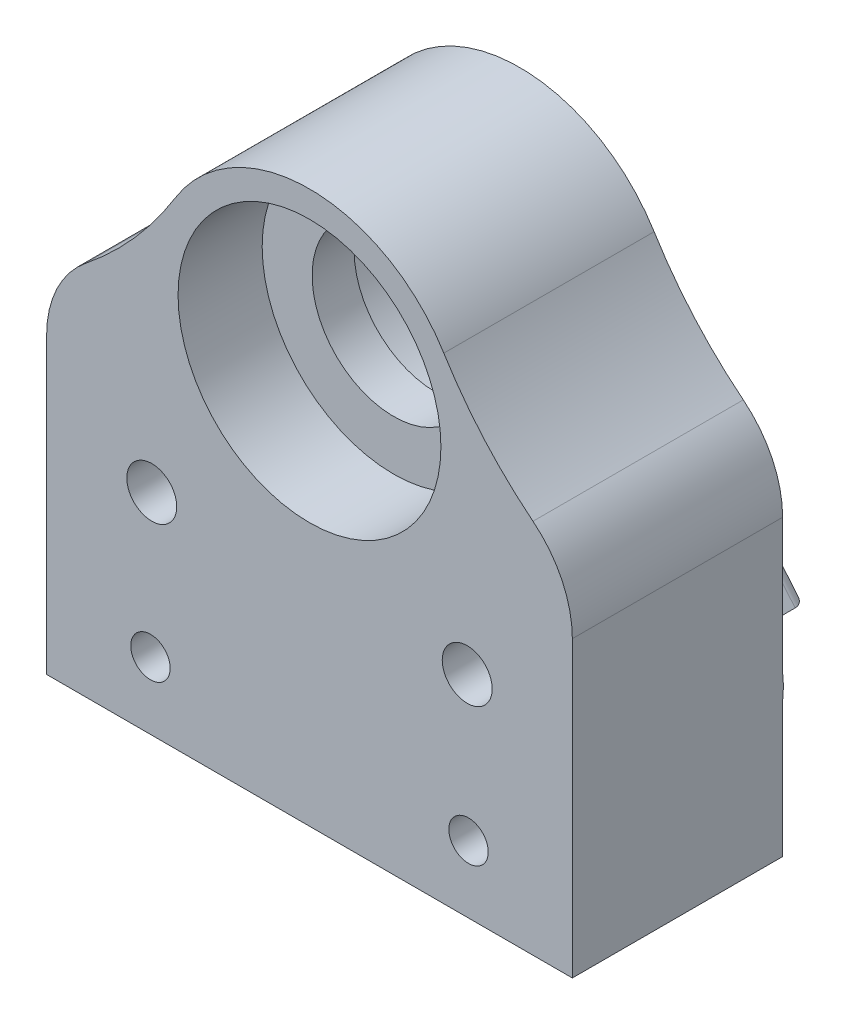
from build123d import *

# Parameters (mm, degrees)
EXTRUDE_1_DEPTH          = 4
EXTRUDE_1_DEPTH_BACK     = 4
SKETCH_2_R               = 0.95
SKETCH_2_R_2             = 0.75
SKETCH_3_R               = 5
CUT_EXTRUDE_1_DEPTH      = 3.2
SKETCH_6_R               = 3.1
CUT_EXTRUDE_2_DEPTH      = 24.749526311
EXTRUDE_3_DEPTH          = 3.2
CUT_EXTRUDE_3_DEPTH      = 1.2
CUT_EXTRUDE_3_DEPTH_BACK = 0.8
SKETCH_10_R              = 0.95
EXTRUDE_4_DEPTH          = 2
FILLET_4_R               = 2
FILLET_START             = -7
FILLET_5_2_DEPTH         = 9
FILLET_START_2           = -2
FILLET_5_3_DEPTH         = 9
SKETCH_11_R              = 1.1
CUT_EXTRUDE_4_DEPTH      = 5


with BuildPart() as part:
    # 草图2 → 凸台-拉伸1 (new, two sides: drawn at the far end of the back side and taken through both)
    with BuildSketch(Plane.XY.offset(-EXTRUDE_1_DEPTH_BACK)):
        with BuildLine():
            Line((-10, 11.178983643), (-10, 0))
            Line((-10, 0), (10, 0))
            Line((10, 0), (10, 11.178983643))
            ThreePointArc((10, 11.178983643), (9.606342006, 12.909387452), (8.502851331, 14.299197613))
            ThreePointArc((8.502851331, 14.299197613), (6.641519688, 16.075059286), (5.11101252, 18.142857143))
            ThreePointArc((5.11101252, 18.142857143), (0, 21), (-5.11101252, 18.142857143))
            ThreePointArc((-5.11101252, 18.142857143), (-6.641519688, 16.075059286), (-8.502851331, 14.299197613))
            ThreePointArc((-8.502851331, 14.299197613), (-9.606342006, 12.909387452), (-10, 11.178983643))
        make_face()
        with Locations((-6, 8)):
            Circle(SKETCH_2_R, mode=Mode.SUBTRACT)
        with Locations((-6.05, 2.55)):
            Circle(SKETCH_2_R_2, mode=Mode.SUBTRACT)
        with Locations(Location((6.05, 2.55, 0), (0, 0, 180))):
            Circle(SKETCH_2_R_2, mode=Mode.SUBTRACT)
        with Locations(Location((6, 8, 0), (0, 0, 180))):
            Circle(SKETCH_2_R, mode=Mode.SUBTRACT)
    extrude(amount=EXTRUDE_1_DEPTH + EXTRUDE_1_DEPTH_BACK)

    # 草图3 → 切除-拉伸1 (cut)
    with BuildSketch(Plane.XY.offset(4)):
        with Locations((0, 15)):
            Circle(SKETCH_3_R)
    cut_extrude_1 = extrude(amount=-CUT_EXTRUDE_1_DEPTH, mode=Mode.SUBTRACT)

    # 镜向1: 切除-拉伸1 across plane
    add(cut_extrude_1.mirror(Plane.XY), mode=Mode.SUBTRACT)

    # 草图6 → 切除-拉伸2 (cut, through all)
    with BuildSketch(Plane.XY.offset(0.8)):
        with Locations((0, 15)):
            Circle(SKETCH_6_R)
    extrude(amount=-CUT_EXTRUDE_2_DEPTH, mode=Mode.SUBTRACT)

    # 草图8 → 凸台-拉伸3 (add)
    with BuildSketch(Plane(origin=(0, 0, -4), x_dir=(-1, 0, 0), z_dir=(0, 0, -1))):
        with BuildLine():
            Line((-3.599610614, 10.710151119), (-7.777730077, 5.730862238))
            ThreePointArc((-7.777730077, 5.730862238), (0, 2.9), (7.777730077, 5.730862238))
            Line((7.777730077, 5.730862238), (3.599610614, 10.710151119))
            ThreePointArc((3.599610614, 10.710151119), (0, 9.4), (-3.599610614, 10.710151119))
        make_face()
    extrude(amount=EXTRUDE_3_DEPTH)

    # 草图9 → 切除-拉伸3 (cut, two sides: drawn at the far end of the back side and taken through both)
    with BuildSketch(Plane(origin=(0, 0, -5.5), x_dir=(-1, 0, 0), z_dir=(0, 0, -1)).offset(-CUT_EXTRUDE_3_DEPTH_BACK)):
        with BuildLine():
            Line((-3.221829655, 10.419627344), (-5.977379212, 5.646875508))
            ThreePointArc((-5.977379212, 5.646875508), (0, 3.9), (5.977379212, 5.646875508))
            Line((5.977379212, 5.646875508), (3.221829655, 10.419627344))
            ThreePointArc((3.221829655, 10.419627344), (0, 9.4), (-3.221829655, 10.419627344))
        make_face()
    extrude(amount=CUT_EXTRUDE_3_DEPTH + CUT_EXTRUDE_3_DEPTH_BACK, mode=Mode.SUBTRACT)

    # 草图10 → 凸台-拉伸4 (add)
    with BuildSketch(Plane(origin=(0, 0, -4), x_dir=(-1, 0, 0), z_dir=(0, 0, -1))):
        with Locations((-6, 8)):
            Circle(SKETCH_10_R)
        with Locations(Location((6, 8, 0), (0, 0, 180))):
            Circle(SKETCH_10_R)
    extrude(amount=-EXTRUDE_4_DEPTH)

    # 圆角4
    # the kernel refuses this fillet: 2 mm, written as the material it adds along each edge
    with BuildSketch(Plane(origin=(10.991668126, 1.900640023, -4), x_dir=(0.7660444431189769, 0.6427876096865407, 0), z_dir=(-0.6427876096865407, 0.7660444431189769, 0))) as fillet_4_piece_1_section:
        with BuildLine():
            CenterArc((FILLET_4_R, FILLET_4_R), FILLET_4_R, 180, 90)
            Line((0, FILLET_4_R), (0, 0))
            Line((0, 0), (FILLET_4_R, 0))
        make_face()
    fillet_4_piece_1 = extrude(amount=16.5, mode=Mode.PRIVATE)
    fillet_4_piece_1 = fillet_4_piece_1 - Plane(origin=(0, 15, -4), x_dir=(-0.6427876096865404, -0.7660444431189772, 0), z_dir=(0, 0, 1)) * Cylinder(5.6, 42, mode=Mode.PRIVATE)
    fillet_4_piece_1 = fillet_4_piece_1 & Plane(origin=(0, 15, -4), x_dir=(0.6427876096865403, -0.7660444431189773, 0), z_dir=(0, 0, 1)) * Cylinder(12.1, 42, mode=Mode.PRIVATE)
    add(fillet_4_piece_1)
    with BuildSketch(Plane(origin=(-0.385672566, 14.540373334, -4), x_dir=(-0.766044443118977, 0.6427876096865406, 0), z_dir=(-0.6427876096865406, -0.7660444431189771, 0))) as fillet_4_piece_2_section:
        with BuildLine():
            CenterArc((FILLET_4_R, FILLET_4_R), FILLET_4_R, 180, 90)
            Line((0, FILLET_4_R), (0, 0))
            Line((0, 0), (FILLET_4_R, 0))
        make_face()
    fillet_4_piece_2 = extrude(amount=16.5, mode=Mode.PRIVATE)
    fillet_4_piece_2 = fillet_4_piece_2 - Plane(origin=(0, 15, -4), x_dir=(-0.6427876096865404, -0.7660444431189772, 0), z_dir=(0, 0, 1)) * Cylinder(5.6, 42, mode=Mode.PRIVATE)
    fillet_4_piece_2 = fillet_4_piece_2 & Plane(origin=(0, 15, -4), x_dir=(0.6427876096865403, -0.7660444431189773, 0), z_dir=(0, 0, 1)) * Cylinder(12.1, 42, mode=Mode.PRIVATE)
    add(fillet_4_piece_2)
    with BuildSketch(Plane(origin=(0, 15, -4), x_dir=(0.6427876096865403, -0.7660444431189772, 0), z_dir=(0.7660444431189772, 0.6427876096865403, 0))) as fillet_4_piece_3_section:
        with BuildLine():
            CenterArc((12.1 + FILLET_4_R, FILLET_4_R), FILLET_4_R, 180, 90)
            Line((12.1, FILLET_4_R), (12.1, 0))
            Line((12.1, 0), (12.1 + FILLET_4_R, 0))
        make_face()
    fillet_4_piece_3 = revolve(axis=Axis((0, 15, -4), (0, 0, -1)), revolution_arc=80, mode=Mode.PRIVATE)
    fillet_4_piece_3 = fillet_4_piece_3 - Plane(origin=(-6.05, 2.55, -4), x_dir=(1, 0, 0), z_dir=(0, 0, -1)) * Cylinder(0.75, 57, mode=Mode.PRIVATE)
    fillet_4_piece_3 = fillet_4_piece_3 - Plane(origin=(6.05, 2.55, -4), x_dir=(-1, 0, 0), z_dir=(0, 0, -1)) * Cylinder(0.75, 57, mode=Mode.PRIVATE)
    add(fillet_4_piece_3)
    with BuildSketch(Plane(origin=(10.991668126, 1.900640023, -4), x_dir=(0.7660444431189769, 0.6427876096865407, 0), z_dir=(-0.6427876096865407, 0.7660444431189769, 0))) as fillet_4_piece_4a_section:
        with BuildLine():
            CenterArc((FILLET_4_R, FILLET_4_R), FILLET_4_R, 180, 90)
            Line((0, FILLET_4_R), (0, 0))
            Line((0, 0), (FILLET_4_R, 0))
        make_face()
    fillet_4_piece_4a = extrude(amount=16.5, mode=Mode.PRIVATE)
    fillet_4_piece_4a = split(fillet_4_piece_4a, bisect_by=Plane(origin=(10, 1.900640023, -4), z_dir=(-1, 0, 0)), keep=Keep.TOP, mode=Mode.PRIVATE)
    fillet_4_piece_4a = fillet_4_piece_4a - Plane(origin=(0, 15, -4), x_dir=(0.6427876096865403, -0.7660444431189773, 0), z_dir=(0, 0, 1)) * Cylinder(12.1, 42, mode=Mode.PRIVATE)
    with BuildSketch(Plane(origin=(0, 15, -4), x_dir=(0.8963584591585163, -0.44333002683663375, 0), z_dir=(0.44333002683663375, 0.8963584591585163, 0))) as fillet_4_piece_4b_section:
        with BuildLine():
            CenterArc((12.1 + FILLET_4_R, FILLET_4_R), FILLET_4_R, 180, 90)
            Line((12.1, FILLET_4_R), (12.1, 0))
            Line((12.1, 0), (12.1 + FILLET_4_R, 0))
        make_face()
    fillet_4_piece_4b = revolve(axis=Axis((0, 15, -4), (0, 0, -1)), revolution_arc=103.683456225, mode=Mode.PRIVATE)
    fillet_4_piece_4b = split(fillet_4_piece_4b, bisect_by=Plane(origin=(10, 15, -4), z_dir=(-1, 0, 0)), keep=Keep.TOP, mode=Mode.PRIVATE)
    fillet_4_piece_4b = split(fillet_4_piece_4b, bisect_by=Plane(origin=(0, 15, -4), z_dir=(0.7660444431189771, 0.6427876096865406, 0)), keep=Keep.TOP, mode=Mode.PRIVATE)
    fillet_4_piece_4 = fillet_4_piece_4a & fillet_4_piece_4b
    add(fillet_4_piece_4)
    with BuildSketch(Plane(origin=(-0.385672566, 14.540373334, -4), x_dir=(-0.766044443118977, 0.6427876096865406, 0), z_dir=(-0.6427876096865406, -0.7660444431189771, 0))) as fillet_4_piece_5a_section:
        with BuildLine():
            CenterArc((FILLET_4_R, FILLET_4_R), FILLET_4_R, 180, 90)
            Line((0, FILLET_4_R), (0, 0))
            Line((0, 0), (FILLET_4_R, 0))
        make_face()
    fillet_4_piece_5a = extrude(amount=16.5, mode=Mode.PRIVATE)
    fillet_4_piece_5a = split(fillet_4_piece_5a, bisect_by=Plane(origin=(-10, 14.540373334, -4), z_dir=(1, 0, 0)), keep=Keep.TOP, mode=Mode.PRIVATE)
    fillet_4_piece_5a = fillet_4_piece_5a - Plane(origin=(0, 15, -4), x_dir=(0.6427876096865403, -0.7660444431189773, 0), z_dir=(0, 0, 1)) * Cylinder(12.1, 42, mode=Mode.PRIVATE)
    with BuildSketch(Plane(origin=(0, 15, -4), x_dir=(0.6427876096865403, -0.7660444431189772, 0), z_dir=(0.7660444431189772, 0.6427876096865403, 0))) as fillet_4_piece_5b_section:
        with BuildLine():
            CenterArc((12.1 + FILLET_4_R, FILLET_4_R), FILLET_4_R, 180, 90)
            Line((12.1, FILLET_4_R), (12.1, 0))
            Line((12.1, 0), (12.1 + FILLET_4_R, 0))
        make_face()
    fillet_4_piece_5b = revolve(axis=Axis((0, 15, -4), (0, 0, -1)), revolution_arc=103.683456225, mode=Mode.PRIVATE)
    fillet_4_piece_5b = split(fillet_4_piece_5b, bisect_by=Plane(origin=(-10, 15, -4), z_dir=(1, 0, 0)), keep=Keep.TOP, mode=Mode.PRIVATE)
    fillet_4_piece_5b = split(fillet_4_piece_5b, bisect_by=Plane(origin=(0, 15, -4), z_dir=(-0.7660444431189771, 0.6427876096865406, 0)), keep=Keep.TOP, mode=Mode.PRIVATE)
    fillet_4_piece_5 = fillet_4_piece_5a & fillet_4_piece_5b
    add(fillet_4_piece_5)

    # 圆角5: read off the stored shape, not the designer's step
    # 圆角5 outline → 圆角5 (revolve, cut)
    with BuildSketch(Plane.XZ.offset(-15)):
        with BuildLine():
            Line((12.1, -7.2), (12.1, -6.7))
            ThreePointArc((12.1, -6.7), (11.953553391, -7.053553391), (11.6, -7.2))
            Line((11.6, -7.2), (12.1, -7.2))
        make_face()
        with BuildLine():
            Line((5.6, -7.2), (6.1, -7.2))
            ThreePointArc((6.1, -7.2), (5.746446609, -7.053553391), (5.6, -6.7))
            Line((5.6, -6.7), (5.6, -7.2))
        make_face()
    revolve(axis=Axis((0, 15, 0), (0, 0, 1)), mode=Mode.SUBTRACT)

    # Fillet 5 2 outline → Fillet 5 2 (cut)
    with BuildSketch(Plane(origin=(0, 0, 0), x_dir=(0.7660444431189767, 0.6427876096865409, 0), z_dir=(0.6427876096865409, -0.7660444431189768, 0)).offset(FILLET_START)):
        with BuildLine():
            Line((9.641814145, -7.2), (9.641814145, -6.7))
            ThreePointArc((9.641814145, -6.7), (9.495367536, -7.053553391), (9.141814145, -7.2))
            Line((9.141814145, -7.2), (9.641814145, -7.2))
        make_face()
    extrude(amount=FILLET_5_2_DEPTH, mode=Mode.SUBTRACT)

    # Fillet 5 3 outline → Fillet 5 3 (cut)
    with BuildSketch(Plane(origin=(0, 0, 0), x_dir=(0.7660444431189767, -0.6427876096865409, 0), z_dir=(0.6427876096865409, 0.7660444431189768, 0)).offset(FILLET_START_2)):
        with BuildLine():
            Line((-9.641814145, 7.2), (-9.641814145, 6.7))
            ThreePointArc((-9.641814145, 6.7), (-9.495367536, 7.053553391), (-9.141814145, 7.2))
            Line((-9.141814145, 7.2), (-9.641814145, 7.2))
        make_face()
    extrude(amount=FILLET_5_3_DEPTH, mode=Mode.SUBTRACT)

    # 草图11 → 切除-拉伸4 (cut)
    with BuildSketch(Plane(origin=(0, 0, 0), x_dir=(1, 0, 0), z_dir=(0, 1, 0))):
        with Locations(Location((0, 5.7, 0), (0, 0, 65.380022671))):
            Circle(SKETCH_11_R)
    extrude(amount=CUT_EXTRUDE_4_DEPTH, mode=Mode.SUBTRACT)


solid = part.part
